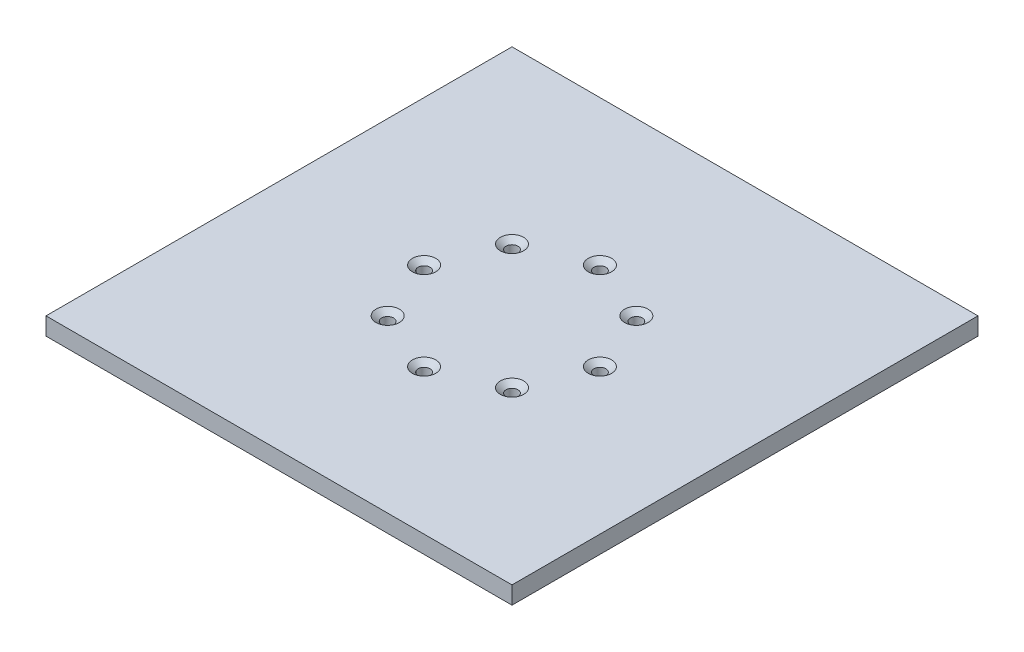
from build123d import *

# Parameters (mm, degrees)
SKETCH1_W                                         = 168.275
SKETCH1_H                                         = 168.275
BOSS_EXTRUDE1_DEPTH                               = 6.35
CSK_FOR_8_FLAT_HEAD_MACHINE_SCREW_100_D           = 4.3053
CSK_FOR_8_FLAT_HEAD_MACHINE_SCREW_100_CSINK_D     = 8.4328
CSK_FOR_8_FLAT_HEAD_MACHINE_SCREW_100_CSINK_ANGLE = 100
CIRPATTERN2_COUNT                                 = 8


with BuildPart() as part:
    # Sketch1 → Boss-Extrude1 (new body)
    with BuildSketch(Plane(origin=(0, 0, 0), x_dir=(1, 0, 0), z_dir=(0, 1, 0))):
        Rectangle(SKETCH1_W, SKETCH1_H)
    extrude(amount=BOSS_EXTRUDE1_DEPTH)

    # CSK for #8 Flat Head Machine Screw (100)1 (through all)
    with Locations(Plane(origin=(0, 6.35, 0), x_dir=(-1, 0, 0), z_dir=(0, 1, 0))):
        with Locations((0, 31.75)):
            csk_for_8_flat_head_machine_screw_100 = CounterSinkHole(CSK_FOR_8_FLAT_HEAD_MACHINE_SCREW_100_D / 2, CSK_FOR_8_FLAT_HEAD_MACHINE_SCREW_100_CSINK_D / 2, counter_sink_angle=CSK_FOR_8_FLAT_HEAD_MACHINE_SCREW_100_CSINK_ANGLE)

    # CirPattern2: CSK for #8 Flat Head Machine Screw (100)1 ×8 about axis
    cirpattern2_axis = Axis((0, 0, 0), (0, 1, 0))
    for i in range(1, CIRPATTERN2_COUNT):
        add(csk_for_8_flat_head_machine_screw_100.rotate(cirpattern2_axis, i * 360 / CIRPATTERN2_COUNT), mode=Mode.SUBTRACT)


solid = part.part
